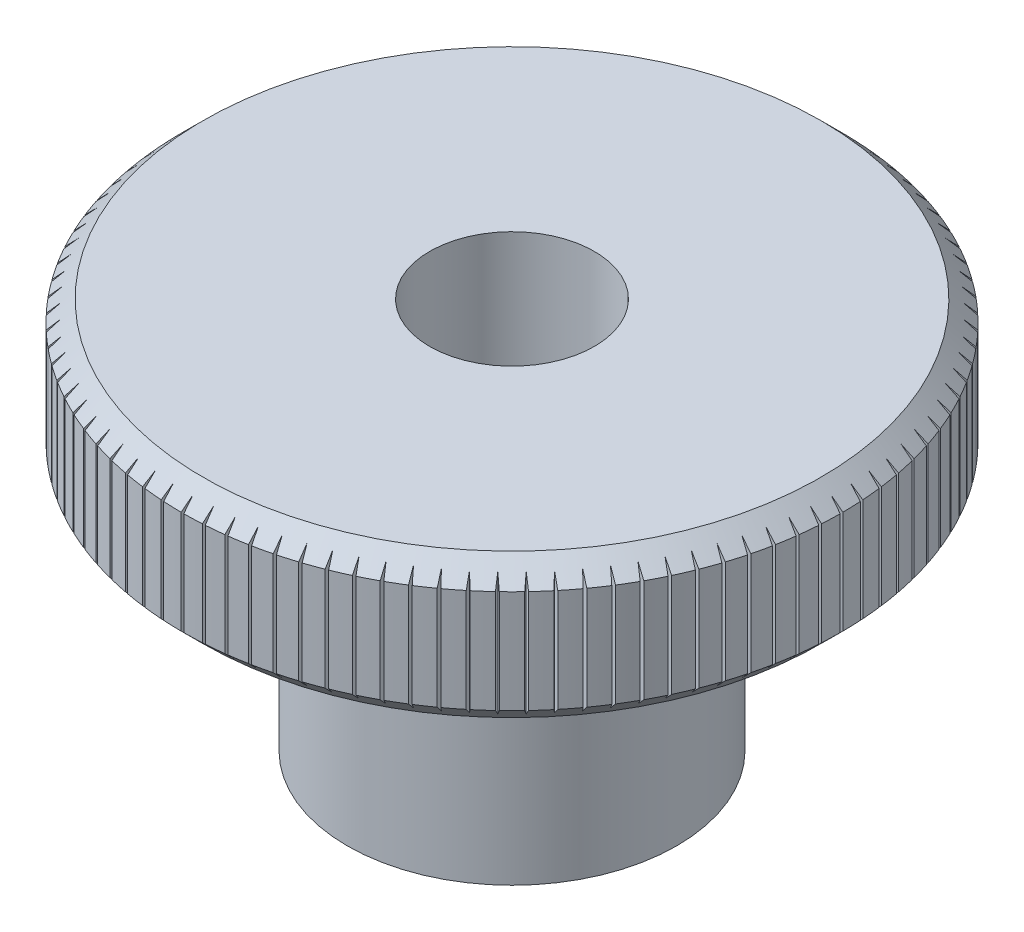
from build123d import *

# Parameters (mm, degrees)
FILLET1_R          = 0.8
CHAMFER1_SIZE      = 0.5
CUT_EXTRUDE1_DEPTH = 15.773286703
CIRPATTERN1_COUNT  = 100


with BuildPart() as part:
    # Sketch1 → Revolve1 (revolve)
    with BuildSketch(Plane.XY):
        Polygon((2, 0), (2, 9.5), (8, 9.5), (8, 6), (4, 6), (4, 0), align=None)
    revolve(axis=Axis((0, 0, 0), (0, -1, 0)))

    # Fillet1
    fillet1_edges = [part.edges().sort_by_distance(p)[0] for p in [
        (-4, 6, 0),
    ]]
    fillet(fillet1_edges, radius=FILLET1_R)

    # Chamfer1
    chamfer1_edges = [part.edges().sort_by_distance(p)[0] for p in [
        (-8, 6, 0),
        (-8, 9.5, 0),
    ]]
    chamfer(chamfer1_edges, length=CHAMFER1_SIZE)

    # Sketch2 → Cut-Extrude1 (cut, through all)
    with BuildSketch(Plane(origin=(0, 9.5, 0), x_dir=(1, 0, 0), z_dir=(0, 1, 0))):
        Polygon((0.032913124, 8), (-0.032913124, 8), (0, 7.75), align=None)
    cut_extrude1 = extrude(amount=-CUT_EXTRUDE1_DEPTH, mode=Mode.SUBTRACT)

    # CirPattern1: Cut-Extrude1 ×100 about axis
    cirpattern1_axis = Axis((0, 0, 0), (0, 1, 0))
    for i in range(1, CIRPATTERN1_COUNT):
        add(cut_extrude1.rotate(cirpattern1_axis, i * 360 / CIRPATTERN1_COUNT), mode=Mode.SUBTRACT)


solid = part.part
